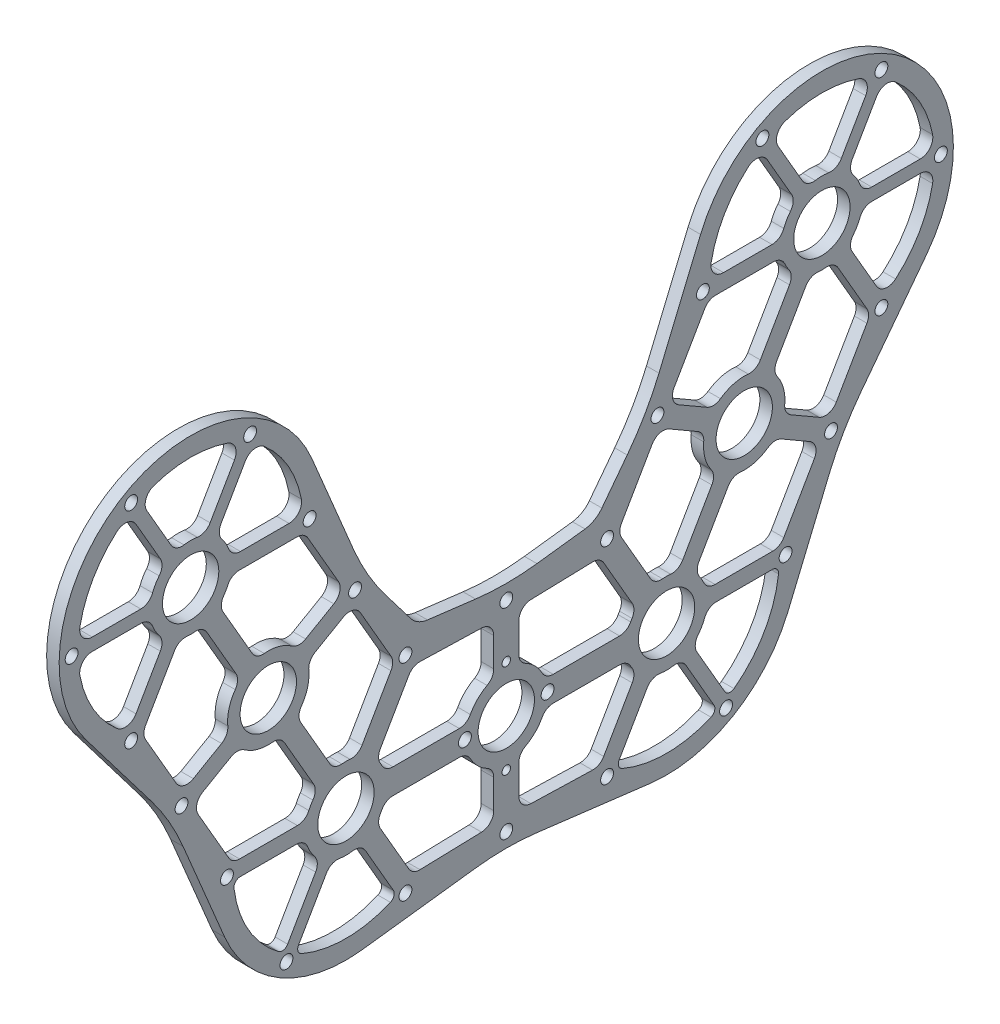
from build123d import *

# Parameters (mm, degrees)
SKETCH1_R                = 3.2639
BOSS_EXTRUDE1_DEPTH      = 6.35
SKETCH2_R                = 14.2875
SKETCH2_R_2              = 2.1463
SKETCH2_R_3              = 3.2639
CUT_EXTRUDE1_DEPTH       = 305.40591495
FILLET2_R                = 127
FILLET4_R                = 12.7
CUT_EXTRUDE3_DEPTH       = 305.40591495
FILLET3_R                = 6.35
CUT_EXTRUDE4_DEPTH       = 305.40591495
FILLET5_R                = 6.35
CIRPATTERN2_COUNT        = 6
FILLET5_OF_CIRPATTERN2_R = 6.35
CUT_EXTRUDE5_DEPTH       = 305.40591495
FILLET6_R                = 6.35
CUT_EXTRUDE6_DEPTH       = 305.40591495
FILLET7_R                = 6.35
CIRPATTERN3_COUNT        = 6
FILLET7_OF_CIRPATTERN3_R = 6.35
MIRROR2_DEPTH            = 6.35


# Read off the part's stored shape, not the designer's step: Mirror2
with BuildPart() as part:
    # Sketch1 → Boss-Extrude1 (new body)
    with BuildSketch(Plane(origin=(0, 0, 0), x_dir=(0, 0, -1), z_dir=(1, 0, 0))):
        with BuildLine():
            Line((71.156648174, 96.765840294), (45.243778605, 62.733564207))
            Line((45.243778605, 62.733564207), (0, 57.15))
            Line((0, 57.15), (-45.243778605, 62.733564207))
            Line((-45.243778605, 62.733564207), (-71.156648174, 96.765840294))
            Line((-71.156648174, 96.765840294), (-98.515888575, 162.126581108))
            ThreePointArc((-98.515888575, 162.126581108), (-193.3575, 194.123924385), (-213.067793581, 95.990007916))
            Line((-213.067793581, 95.990007916), (-170.143351826, 39.615840294))
            Line((-170.143351826, 39.615840294), (-142.784111425, -25.74490052))
            ThreePointArc((-142.784111425, -25.74490052), (-114.743922337, -57.669069065), (-73.113548096, -66.172990625))
            Line((-73.113548096, -66.172990625), (0, -57.15))
            Line((0, -57.15), (73.113548096, -66.172990625))
            ThreePointArc((73.113548096, -66.172990625), (114.743922337, -57.669069065), (142.784111425, -25.74490052))
            Line((142.784111425, -25.74490052), (170.143351826, 39.615840294))
            Line((170.143351826, 39.615840294), (213.067793581, 95.990007916))
            ThreePointArc((213.067793581, 95.990007916), (193.3575, 194.123924385), (98.515888575, 162.126581108))
            Line((98.515888575, 162.126581108), (71.156648174, 96.765840294))
        make_face()
        with Locations((-111.4425, -52.242982483)):
            Circle(SKETCH1_R, mode=Mode.SUBTRACT)
        with Locations((-51.1175, -52.242982483)):
            Circle(SKETCH1_R, mode=Mode.SUBTRACT)
        with Locations((-141.605, 0)):
            Circle(SKETCH1_R, mode=Mode.SUBTRACT)
        with Locations((-20.955, 0)):
            Circle(SKETCH1_R, mode=Mode.SUBTRACT)
        with Locations((51.1175, -52.242982483)):
            Circle(SKETCH1_R, mode=Mode.SUBTRACT)
        with Locations((111.4425, -52.242982483)):
            Circle(SKETCH1_R, mode=Mode.SUBTRACT)
        with Locations((20.955, 0)):
            Circle(SKETCH1_R, mode=Mode.SUBTRACT)
        with Locations((141.605, 0)):
            Circle(SKETCH1_R, mode=Mode.SUBTRACT)
        with Locations((-164.644090512, 42.790840294)):
            Circle(SKETCH1_R, mode=Mode.SUBTRACT)
        with Locations((-51.1175, 52.242982483)):
            Circle(SKETCH1_R, mode=Mode.SUBTRACT)
        with Locations((-76.655909488, 93.590840294)):
            Circle(SKETCH1_R, mode=Mode.SUBTRACT)
        with Locations((51.1175, 52.242982483)):
            Circle(SKETCH1_R, mode=Mode.SUBTRACT)
        with Locations((164.644090512, 42.790840294)):
            Circle(SKETCH1_R, mode=Mode.SUBTRACT)
        with Locations((76.655909488, 93.590840294)):
            Circle(SKETCH1_R, mode=Mode.SUBTRACT)
        with Locations((-99.695, 136.381680588)):
            Circle(SKETCH1_R, mode=Mode.SUBTRACT)
        with Locations((-129.8575, 188.624663071)):
            Circle(SKETCH1_R, mode=Mode.SUBTRACT)
        with Locations((-190.1825, 84.138698105)):
            Circle(SKETCH1_R, mode=Mode.SUBTRACT)
        with Locations((-220.345, 136.381680588)):
            Circle(SKETCH1_R, mode=Mode.SUBTRACT)
        with Locations((-190.1825, 188.624663071)):
            Circle(SKETCH1_R, mode=Mode.SUBTRACT)
        with Locations((190.1825, 188.624663071)):
            Circle(SKETCH1_R, mode=Mode.SUBTRACT)
        with Locations((190.1825, 84.138698105)):
            Circle(SKETCH1_R, mode=Mode.SUBTRACT)
        with Locations((99.695, 136.381680588)):
            Circle(SKETCH1_R, mode=Mode.SUBTRACT)
        with Locations((220.345, 136.381680588)):
            Circle(SKETCH1_R, mode=Mode.SUBTRACT)
        with Locations((129.8575, 188.624663071)):
            Circle(SKETCH1_R, mode=Mode.SUBTRACT)
    extrude(amount=BOSS_EXTRUDE1_DEPTH)

    # Sketch2 → Cut-Extrude1 (cut, through all)
    with BuildSketch(Plane(origin=(6.35, 0, 0), x_dir=(0, 0, -1), z_dir=(1, 0, 0))):
        with Locations((81.28, 0)):
            Circle(SKETCH2_R)
        Circle(SKETCH2_R)
        with Locations((-81.28, 0)):
            Circle(SKETCH2_R)
        with Locations((0, -23.8125)):
            Circle(SKETCH2_R_2)
        with Locations((0, 23.8125)):
            Circle(SKETCH2_R_2)
        with Locations((0, -50.8)):
            Circle(SKETCH2_R_3)
        with Locations((0, 50.8)):
            Circle(SKETCH2_R_3)
        with Locations((160.02, 136.381680588)):
            Circle(SKETCH2_R)
        with Locations((120.65, 68.190840294)):
            Circle(SKETCH2_R)
        with Locations((-120.65, 68.190840294)):
            Circle(SKETCH2_R)
        with Locations((-160.02, 136.381680588)):
            Circle(SKETCH2_R)
    extrude(amount=-CUT_EXTRUDE1_DEPTH, mode=Mode.SUBTRACT)

    # Fillet2
    fillet2_edges = [part.edges().sort_by_distance(p)[0] for p in [
        (3.175, 39.615840294, -170.143351826),
        (3.175, -57.15, 0),
        (3.175, 39.615840294, 170.143351826),
        (3.175, 96.765840294, 71.156648174),
        (3.175, 57.15, 0),
        (3.175, 96.765840294, -71.156648174),
    ]]
    fillet(fillet2_edges, radius=FILLET2_R)

    # Fillet4
    fillet4_edges = [part.edges().sort_by_distance(p)[0] for p in [
        (3.175, 62.733564207, 45.243778605),
        (3.175, 62.733564207, -45.243778605),
    ]]
    fillet(fillet4_edges, radius=FILLET4_R)

    # Sketch4 → Cut-Extrude3 (cut, through all)
    with BuildSketch(Plane(origin=(6.35, 0, 0), x_dir=(0, 0, -1), z_dir=(1, 0, 0))):
        with BuildLine():
            ThreePointArc((-61.643709458, -6.35), (-63.407400729, -10.31875), (-65.962593415, -13.830526445))
            Line((-65.962593415, -13.830526445), (-47.511555429, -45.788661689))
            Line((-47.511555429, -45.788661689), (-6.35, -44.626722951))
            Line((-6.35, -44.626722951), (-6.35, -19.636290542))
            ThreePointArc((-6.35, -19.636290542), (-14.592916197, -14.592916197), (-19.636290542, -6.35))
            Line((-19.636290542, -6.35), (-61.643709458, -6.35))
        make_face()
        with BuildLine():
            Line((-47.511555429, 45.788661689), (-65.962593415, 13.830526445))
            ThreePointArc((-65.962593415, 13.830526445), (-63.407400729, 10.31875), (-61.643709458, 6.35))
            Line((-61.643709458, 6.35), (-19.636290542, 6.35))
            ThreePointArc((-19.636290542, 6.35), (-14.592916197, 14.592916197), (-6.35, 19.636290542))
            Line((-6.35, 19.636290542), (-6.35, 44.626722951))
            Line((-6.35, 44.626722951), (-47.511555429, 45.788661689))
        make_face()
    extrude(amount=-CUT_EXTRUDE3_DEPTH, mode=Mode.SUBTRACT)

    # Fillet3
    fillet3_edges = [part.edges().sort_by_distance(p)[0] for p in [
        (3.175, -6.35, 19.636290542),
        (3.175, -19.636290542, 6.35),
        (3.175, -44.626722951, 6.35),
        (3.175, -45.788661689, 47.511555429),
        (3.175, -13.830526445, 65.962593415),
        (3.175, -6.35, 61.643709458),
        (3.175, 19.636290542, 6.35),
        (3.175, 6.35, 19.636290542),
        (3.175, 6.35, 61.643709458),
        (3.175, 13.830526445, 65.962593415),
        (3.175, 45.788661689, 47.511555429),
        (3.175, 44.626722951, 6.35),
    ]]
    fillet(fillet3_edges, radius=FILLET3_R)

    # Sketch5 → Cut-Extrude4 (cut, through all)
    with BuildSketch(Plane(origin=(6.35, 0, 0), x_dir=(0, 0, -1), z_dir=(1, 0, 0))):
        with BuildLine():
            Line((-88.726272702, -19.247322647), (-105.330453881, -48.006608067))
            ThreePointArc((-105.330453881, -48.006608067), (-105.593886294, -50.595145498), (-103.833812825, -52.511408542))
            ThreePointArc((-103.833812825, -52.511408542), (-81.28, -57.15), (-58.726187175, -52.511408542))
            ThreePointArc((-58.726187175, -52.511408542), (-56.966113706, -50.595145498), (-57.229546119, -48.006608067))
            Line((-57.229546119, -48.006608067), (-73.833727298, -19.247322647))
            ThreePointArc((-73.833727298, -19.247322647), (-81.28, -20.6375), (-88.726272702, -19.247322647))
        make_face()
    cut_extrude4 = extrude(amount=-CUT_EXTRUDE4_DEPTH, mode=Mode.SUBTRACT)

    # Fillet5
    fillet5_edges = [part.edges().sort_by_distance(p)[0] for p in [
        (3.175, -19.247322647, 88.726272702),
        (3.175, -19.247322647, 73.833727298),
    ]]
    fillet(fillet5_edges, radius=FILLET5_R)

    # CirPattern2: Cut-Extrude4 ×6 about axis, 4 skipped
    cirpattern2_axis = Axis((0, 0, 81.28), (1, 0, 0))
    add([cut_extrude4.rotate(cirpattern2_axis, i * 360 / CIRPATTERN2_COUNT) for i in range(1, CIRPATTERN2_COUNT) if i not in (1, 2, 3, 4)], mode=Mode.SUBTRACT)

    # Fillet5 of CirPattern2
    fillet5_of_cirpattern2_edges = [part.edges().sort_by_distance(p)[0] for p in [
        (3.175, -3.175, 101.671806719),
        (3.175, -16.072322647, 94.225534016),
    ]]
    fillet(fillet5_of_cirpattern2_edges, radius=FILLET5_OF_CIRPATTERN2_R)

    # Sketch6 → Cut-Extrude5 (cut, through all)
    with BuildSketch(Plane(origin=(6.35, 0, 0), x_dir=(0, 0, -1), z_dir=(1, 0, 0))):
        with BuildLine():
            Line((-165.935785586, 116.610239387), (-184.683238686, 84.138698105))
            Line((-184.683238686, 84.138698105), (-164.150554014, 48.575045038))
            Line((-164.150554014, 48.575045038), (-140.421441201, 62.275054708))
            ThreePointArc((-140.421441201, 62.275054708), (-140.58429424, 73.532218337), (-134.814677557, 83.199781495))
            Line((-134.814677557, 83.199781495), (-154.104214414, 116.610239387))
            ThreePointArc((-154.104214414, 116.610239387), (-160.02, 115.744180588), (-165.935785586, 116.610239387))
        make_face()
        with BuildLine():
            Line((-102.444630657, 131.619180588), (-139.939536858, 131.619180588))
            ThreePointArc((-139.939536858, 131.619180588), (-142.147400729, 126.062930588), (-145.855322443, 121.372739387))
            Line((-145.855322443, 121.372739387), (-126.565785586, 87.962281495))
            ThreePointArc((-126.565785586, 87.962281495), (-115.308621957, 88.125134534), (-105.641058799, 82.355517851))
            Line((-105.641058799, 82.355517851), (-81.911945986, 96.055527521))
            Line((-81.911945986, 96.055527521), (-102.444630657, 131.619180588))
        make_face()
        with BuildLine():
            ThreePointArc((-100.0125, 68.190840294), (-101.699670988, 60.01823749), (-106.485322443, 53.181899093))
            Line((-106.485322443, 53.181899093), (-87.195785586, 19.771441201))
            ThreePointArc((-87.195785586, 19.771441201), (-81.28, 20.6375), (-75.364214414, 19.771441201))
            Line((-75.364214414, 19.771441201), (-56.616761314, 52.242982483))
            Line((-56.616761314, 52.242982483), (-77.149445986, 87.80663555))
            Line((-77.149445986, 87.80663555), (-100.878558799, 74.106625879))
            ThreePointArc((-100.878558799, 74.106625879), (-100.230162537, 71.180262351), (-100.0125, 68.190840294))
        make_face()
        with BuildLine():
            Line((-135.658941201, 54.026162737), (-159.388054014, 40.326153067))
            Line((-159.388054014, 40.326153067), (-138.855369343, 4.7625))
            Line((-138.855369343, 4.7625), (-101.360463142, 4.7625))
            ThreePointArc((-101.360463142, 4.7625), (-99.152599271, 10.31875), (-95.444677557, 15.008941201))
            Line((-95.444677557, 15.008941201), (-114.734214414, 48.419399093))
            ThreePointArc((-114.734214414, 48.419399093), (-125.991378043, 48.256546054), (-135.658941201, 54.026162737))
        make_face()
    extrude(amount=-CUT_EXTRUDE5_DEPTH, mode=Mode.SUBTRACT)

    # Fillet6
    fillet6_edges = [part.edges().sort_by_distance(p)[0] for p in [
        (3.175, 19.771441201, 75.364214414),
        (3.175, 19.771441201, 87.195785586),
        (3.175, 53.181899093, 106.485322443),
        (3.175, 74.106625879, 100.878558799),
        (3.175, 87.80663555, 77.149445986),
        (3.175, 52.242982483, 56.616761314),
        (3.175, 82.355517851, 105.641058799),
        (3.175, 87.962281495, 126.565785586),
        (3.175, 121.372739387, 145.855322443),
        (3.175, 131.619180588, 139.939536858),
        (3.175, 131.619180588, 102.444630657),
        (3.175, 96.055527521, 81.911945986),
        (3.175, 15.008941201, 95.444677557),
        (3.175, 4.7625, 101.360463142),
        (3.175, 4.7625, 138.855369343),
        (3.175, 40.326153067, 159.388054014),
        (3.175, 54.026162737, 135.658941201),
        (3.175, 48.419399093, 114.734214414),
        (3.175, 83.199781495, 134.814677557),
        (3.175, 62.275054708, 140.421441201),
        (3.175, 48.575045038, 164.150554014),
        (3.175, 84.138698105, 184.683238686),
        (3.175, 116.610239387, 165.935785586),
        (3.175, 116.610239387, 154.104214414),
    ]]
    fillet(fillet6_edges, radius=FILLET6_R)

    # Sketch7 → Cut-Extrude6 (cut, through all)
    with BuildSketch(Plane(origin=(6.35, 0, 0), x_dir=(0, 0, -1), z_dir=(1, 0, 0))):
        with BuildLine():
            Line((-180.411806719, 133.206680588), (-217.081737399, 133.206680588))
            ThreePointArc((-217.081737399, 133.206680588), (-209.513351826, 107.806680588), (-191.300499357, 88.552266416))
            Line((-191.300499357, 88.552266416), (-172.965534016, 120.309357941))
            ThreePointArc((-172.965534016, 120.309357941), (-177.892599271, 126.062930588), (-180.411806719, 133.206680588))
        make_face()
    cut_extrude6 = extrude(amount=-CUT_EXTRUDE6_DEPTH, mode=Mode.SUBTRACT)

    # Fillet7
    fillet7_edges = [part.edges().sort_by_distance(p)[0] for p in [
        (3.175, 133.206680588, 180.411806719),
        (3.175, 120.309357941, 172.965534016),
        (3.175, 88.552266416, 191.300499357),
        (3.175, 133.206680588, 217.081737399),
    ]]
    fillet(fillet7_edges, radius=FILLET7_R)

    # CirPattern3: Cut-Extrude6 ×6 about axis, 2 skipped
    cirpattern3_axis = Axis((6.35, 136.381680588, 160.02), (1, 0, 0))
    add([cut_extrude6.rotate(cirpattern3_axis, i * 360 / CIRPATTERN3_COUNT) for i in range(1, CIRPATTERN3_COUNT) if i not in (1, 2)], mode=Mode.SUBTRACT)

    # Fillet7 of CirPattern3
    fillet7_of_cirpattern3_edges = [part.edges().sort_by_distance(p)[0] for p in [
        (3.175, 139.556680588, 139.628193281),
        (3.175, 152.454003235, 147.074465984),
        (3.175, 184.21109476, 128.739500643),
        (3.175, 139.556680588, 102.958262601),
        (3.175, 155.629003235, 152.573727298),
        (3.175, 155.629003235, 167.466272702),
        (3.175, 187.38609476, 185.801238043),
        (3.175, 187.38609476, 134.238761957),
        (3.175, 152.454003235, 172.965534016),
        (3.175, 139.556680588, 180.411806719),
        (3.175, 139.556680588, 217.081737399),
        (3.175, 184.21109476, 191.300499357),
    ]]
    fillet(fillet7_of_cirpattern3_edges, radius=FILLET7_OF_CIRPATTERN3_R)

    # Mirror2 outline → Mirror2 (cut)
    with BuildSketch(Plane.YZ):
        with BuildLine():
            ThreePointArc((18.209558824, -9.711764706), (14.592916197, -14.592916197), (9.711764706, -18.209558824))
            ThreePointArc((9.711764706, -18.209558824), (7.254919922, -20.545451953), (6.35, -23.8125))
            Line((6.35, -23.8125), (6.35, -57.4675))
            ThreePointArc((6.35, -57.4675), (7.254919922, -60.734548047), (9.711764706, -63.070441176))
            ThreePointArc((9.711764706, -63.070441176), (10.31875, -63.407400729), (10.91405818, -63.764585637))
            ThreePointArc((10.91405818, -63.764585637), (14.165423363, -64.724329069), (17.447229928, -63.874488686))
            Line((17.447229928, -63.874488686), (42.509340895, -49.404872172))
            ThreePointArc((42.509340895, -49.404872172), (44.877854477, -47.002699358), (45.68181237, -43.726429753))
            Line((45.68181237, -43.726429753), (44.800917377, -12.520818895))
            ThreePointArc((44.800917377, -12.520818895), (42.879770561, -8.146962551), (38.453445901, -6.35))
            Line((38.453445901, -6.35), (23.8125, -6.35))
            ThreePointArc((23.8125, -6.35), (20.545451953, -7.254919922), (18.209558824, -9.711764706))
        make_face()
        with BuildLine():
            ThreePointArc((-9.711764706, -18.209558824), (-14.592916197, -14.592916197), (-18.209558824, -9.711764706))
            ThreePointArc((-18.209558824, -9.711764706), (-20.545451953, -7.254919922), (-23.8125, -6.35))
            Line((-23.8125, -6.35), (-38.453445901, -6.35))
            ThreePointArc((-38.453445901, -6.35), (-42.879770561, -8.146962551), (-44.800917377, -12.520818895))
            Line((-44.800917377, -12.520818895), (-45.68181237, -43.726429753))
            ThreePointArc((-45.68181237, -43.726429753), (-44.877854477, -47.002699358), (-42.509340895, -49.404872172))
            Line((-42.509340895, -49.404872172), (-17.447229928, -63.874488686))
            ThreePointArc((-17.447229928, -63.874488686), (-14.165423363, -64.724329069), (-10.91405818, -63.764585637))
            ThreePointArc((-10.91405818, -63.764585637), (-10.31875, -63.407400729), (-9.711764706, -63.070441176))
            ThreePointArc((-9.711764706, -63.070441176), (-7.254919922, -60.734548047), (-6.35, -57.4675))
            Line((-6.35, -57.4675), (-6.35, -23.8125))
            ThreePointArc((-6.35, -23.8125), (-7.254919922, -20.545451953), (-9.711764706, -18.209558824))
        make_face()
        with BuildLine():
            ThreePointArc((-6.723529412, -138.033120198), (-4.241129554, -137.253624456), (-3.175, -134.880169076))
            Line((-3.175, -134.880169076), (-3.175, -106.530733281))
            ThreePointArc((-3.175, -106.530733281), (-4.302262663, -102.918875767), (-7.283823529, -100.589384274))
            ThreePointArc((-7.283823529, -100.589384274), (-10.31875, -99.152599271), (-13.080505548, -97.24266835))
            ThreePointArc((-13.080505548, -97.24266835), (-16.588684792, -95.825306643), (-20.280276486, -96.654997298))
            Line((-20.280276486, -96.654997298), (-44.831608067, -110.829715195))
            ThreePointArc((-44.831608067, -110.829715195), (-46.354015944, -112.939738162), (-45.78787913, -115.479307373))
            ThreePointArc((-45.78787913, -115.479307373), (-28.575, -130.773351826), (-6.723529412, -138.033120198))
        make_face()
        with BuildLine():
            Line((4.7625, -105.873444248), (4.7625, -135.189195134))
            ThreePointArc((4.7625, -135.189195134), (5.613238686, -138.364195134), (7.9375, -140.688456448))
            Line((7.9375, -140.688456448), (34.826891753, -156.213054014))
            ThreePointArc((34.826891753, -156.213054014), (39.645392689, -156.847421697), (43.501153067, -153.8887927))
            Line((43.501153067, -153.8887927), (51.769672184, -139.567297486))
            ThreePointArc((51.769672184, -139.567297486), (52.612600036, -136.07743786), (51.42815897, -132.688227489))
            ThreePointArc((51.42815897, -132.688227489), (48.256546054, -125.991378043), (47.654818687, -118.60592984))
            ThreePointArc((47.654818687, -118.60592984), (46.985969555, -115.078567027), (44.511042808, -112.477723861))
            Line((44.511042808, -112.477723861), (18.917297486, -97.70116811))
            ThreePointArc((18.917297486, -97.70116811), (15.42743786, -96.858240258), (12.038227489, -98.042681324))
            ThreePointArc((12.038227489, -98.042681324), (10.31875, -99.152599271), (8.497794118, -100.086751484))
            ThreePointArc((8.497794118, -100.086751484), (5.77743288, -102.42967323), (4.7625, -105.873444248))
        make_face()
        with BuildLine():
            Line((131.619180588, -135.426555752), (131.619180588, -106.110804866))
            ThreePointArc((131.619180588, -106.110804866), (130.768441902, -102.935804866), (128.444180588, -100.611543552))
            Line((128.444180588, -100.611543552), (101.554788835, -85.086945986))
            ThreePointArc((101.554788835, -85.086945986), (96.736287899, -84.452578303), (92.880527521, -87.4112073))
            Line((92.880527521, -87.4112073), (84.612008404, -101.732702514))
            ThreePointArc((84.612008404, -101.732702514), (83.769080552, -105.22256214), (84.953521618, -108.611772511))
            ThreePointArc((84.953521618, -108.611772511), (88.125134534, -115.308621957), (88.726861901, -122.69407016))
            ThreePointArc((88.726861901, -122.69407016), (89.395711033, -126.221432973), (91.87063778, -128.822276139))
            Line((91.87063778, -128.822276139), (117.464383102, -143.59883189))
            ThreePointArc((117.464383102, -143.59883189), (120.954242728, -144.441759742), (124.343453099, -143.257318676))
            ThreePointArc((124.343453099, -143.257318676), (126.062930588, -142.147400729), (127.88388647, -141.213248516))
            ThreePointArc((127.88388647, -141.213248516), (130.604247708, -138.87032677), (131.619180588, -135.426555752))
        make_face()
        with BuildLine():
            ThreePointArc((125.666055588, -216.156422053), (130.904027327, -214.812045439), (133.206680588, -209.919041824))
            Line((133.206680588, -209.919041824), (133.206680588, -185.270733281))
            ThreePointArc((133.206680588, -185.270733281), (132.079417925, -181.658875767), (129.097857059, -179.329384274))
            ThreePointArc((129.097857059, -179.329384274), (126.062930588, -177.892599271), (123.30117504, -175.98266835))
            ThreePointArc((123.30117504, -175.98266835), (119.792995796, -174.565306643), (116.101404102, -175.394997298))
            Line((116.101404102, -175.394997298), (94.755342743, -187.719151569))
            ThreePointArc((94.755342743, -187.719151569), (91.669203943, -192.159809597), (93.123925513, -197.368214494))
            ThreePointArc((93.123925513, -197.368214494), (107.806680588, -209.513351826), (125.666055588, -216.156422053))
        make_face()
        with BuildLine():
            ThreePointArc((147.097305588, -103.883577947), (141.859333849, -105.227954561), (139.556680588, -110.120958176))
            Line((139.556680588, -110.120958176), (139.556680588, -134.769266719))
            ThreePointArc((139.556680588, -134.769266719), (140.683943251, -138.381124233), (143.665504117, -140.710615726))
            ThreePointArc((143.665504117, -140.710615726), (146.700430588, -142.147400729), (149.462186136, -144.05733165))
            ThreePointArc((149.462186136, -144.05733165), (152.97036538, -145.474693357), (156.661957074, -144.645002702))
            Line((156.661957074, -144.645002702), (178.008018432, -132.320848431))
            ThreePointArc((178.008018432, -132.320848431), (181.094157233, -127.880190403), (179.639435663, -122.671785506))
            ThreePointArc((179.639435663, -122.671785506), (164.956680588, -110.526648174), (147.097305588, -103.883577947))
        make_face()
        with BuildLine():
            ThreePointArc((143.665504117, -179.329384274), (140.683943251, -181.658875767), (139.556680588, -185.270733281))
            Line((139.556680588, -185.270733281), (139.556680588, -209.919041824))
            ThreePointArc((139.556680588, -209.919041824), (141.859333849, -214.812045439), (147.097305588, -216.156422053))
            ThreePointArc((147.097305588, -216.156422053), (164.956680588, -209.513351826), (179.639435663, -197.368214494))
            ThreePointArc((179.639435663, -197.368214494), (181.094157233, -192.159809597), (178.008018432, -187.719151569))
            Line((178.008018432, -187.719151569), (156.661957074, -175.394997298))
            ThreePointArc((156.661957074, -175.394997298), (152.97036538, -174.565306643), (149.462186136, -175.98266835))
            ThreePointArc((149.462186136, -175.98266835), (146.700430588, -177.892599271), (143.665504117, -179.329384274))
        make_face()
        with BuildLine():
            ThreePointArc((-20.364329077, -84.626715924), (-20.6375, -81.28), (-20.364329077, -77.933284076))
            ThreePointArc((-20.364329077, -77.933284076), (-20.890947455, -74.186430876), (-23.455276486, -71.404264016))
            Line((-23.455276486, -71.404264016), (-48.006608067, -57.229546119))
            ThreePointArc((-48.006608067, -57.229546119), (-50.595145498, -56.966113706), (-52.511408542, -58.726187175))
            ThreePointArc((-52.511408542, -58.726187175), (-57.15, -81.28), (-52.511408542, -103.833812825))
            ThreePointArc((-52.511408542, -103.833812825), (-50.595145498, -105.593886294), (-48.006608067, -105.330453881))
            Line((-48.006608067, -105.330453881), (-23.455276486, -91.155735984))
            ThreePointArc((-23.455276486, -91.155735984), (-20.890947455, -88.373569124), (-20.364329077, -84.626715924))
        make_face()
        with BuildLine():
            ThreePointArc((20.536021607, -79.23592984), (20.6375, -81.28), (20.536021607, -83.32407016))
            ThreePointArc((20.536021607, -83.32407016), (21.204870739, -86.851432973), (23.679797486, -89.452276139))
            Line((23.679797486, -89.452276139), (49.273542808, -104.22883189))
            ThreePointArc((49.273542808, -104.22883189), (52.763402434, -105.071759742), (56.152612805, -103.887318676))
            ThreePointArc((56.152612805, -103.887318676), (62.849462251, -100.71570576), (70.234910454, -100.113978393))
            ThreePointArc((70.234910454, -100.113978393), (73.762273267, -99.445129261), (76.363116433, -96.970202514))
            Line((76.363116433, -96.970202514), (84.63163555, -82.6487073))
            ThreePointArc((84.63163555, -82.6487073), (85.266003233, -77.830206364), (82.307374236, -73.974445986))
            Line((82.307374236, -73.974445986), (55.417982483, -58.449848419))
            ThreePointArc((55.417982483, -58.449848419), (52.242982483, -57.599109733), (49.067982483, -58.449848419))
            Line((49.067982483, -58.449848419), (23.679797486, -73.107723861))
            ThreePointArc((23.679797486, -73.107723861), (21.204870739, -75.708567027), (20.536021607, -79.23592984))
        make_face()
        with BuildLine():
            ThreePointArc((80.229067783, -137.412681324), (73.532218337, -140.58429424), (66.146770134, -141.186021607))
            ThreePointArc((66.146770134, -141.186021607), (62.619407321, -141.854870739), (60.018564155, -144.329797486))
            Line((60.018564155, -144.329797486), (51.750045038, -158.6512927))
            ThreePointArc((51.750045038, -158.6512927), (51.115677355, -163.469793636), (54.074306352, -167.325554014))
            Line((54.074306352, -167.325554014), (80.963698105, -182.850151581))
            ThreePointArc((80.963698105, -182.850151581), (84.138698105, -183.700890267), (87.313698105, -182.850151581))
            Line((87.313698105, -182.850151581), (112.701883102, -168.192276139))
            ThreePointArc((112.701883102, -168.192276139), (115.176809849, -165.591432973), (115.845658981, -162.06407016))
            ThreePointArc((115.845658981, -162.06407016), (115.744180588, -160.02), (115.845658981, -157.97592984))
            ThreePointArc((115.845658981, -157.97592984), (115.176809849, -154.448567027), (112.701883102, -151.847723861))
            Line((112.701883102, -151.847723861), (87.10813778, -137.07116811))
            ThreePointArc((87.10813778, -137.07116811), (83.618278154, -136.228240258), (80.229067783, -137.412681324))
        make_face()
        with BuildLine():
            ThreePointArc((156.746009665, -156.673284076), (157.019180588, -160.02), (156.746009665, -163.366715924))
            ThreePointArc((156.746009665, -163.366715924), (157.272628043, -167.113569124), (159.836957074, -169.895735984))
            Line((159.836957074, -169.895735984), (181.183018432, -182.219890255))
            ThreePointArc((181.183018432, -182.219890255), (186.571810494, -182.672235842), (190.355060663, -178.808207559))
            ThreePointArc((190.355060663, -178.808207559), (193.531680588, -160.02), (190.355060663, -141.231792441))
            ThreePointArc((190.355060663, -141.231792441), (186.571810494, -137.367764158), (181.183018432, -137.820109745))
            Line((181.183018432, -137.820109745), (159.836957074, -150.144264016))
            ThreePointArc((159.836957074, -150.144264016), (157.272628043, -152.926430876), (156.746009665, -156.673284076))
        make_face()
    extrude(amount=MIRROR2_DEPTH, mode=Mode.SUBTRACT)


solid = part.part
